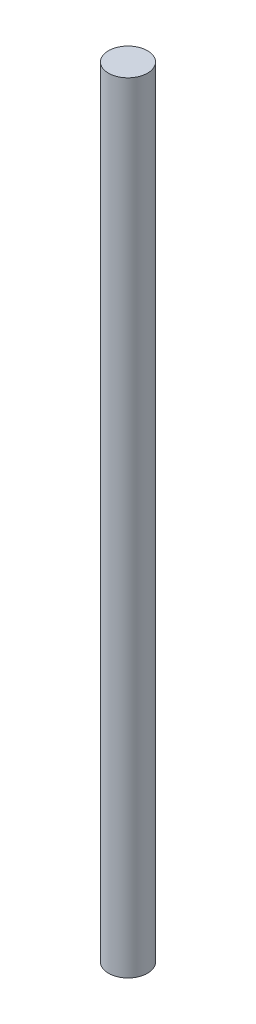
from build123d import *

# Parameters (mm, degrees)
SKETCH1_R           = 1.4732
BOSS_EXTRUDE1_DEPTH = 58.9026


with BuildPart() as part:
    # Sketch1 → Boss-Extrude1 (new body)
    with BuildSketch(Plane(origin=(0, 0, 0), x_dir=(1, 0, 0), z_dir=(0, 1, 0))):
        Circle(SKETCH1_R)
    extrude(amount=BOSS_EXTRUDE1_DEPTH)


solid = part.part
